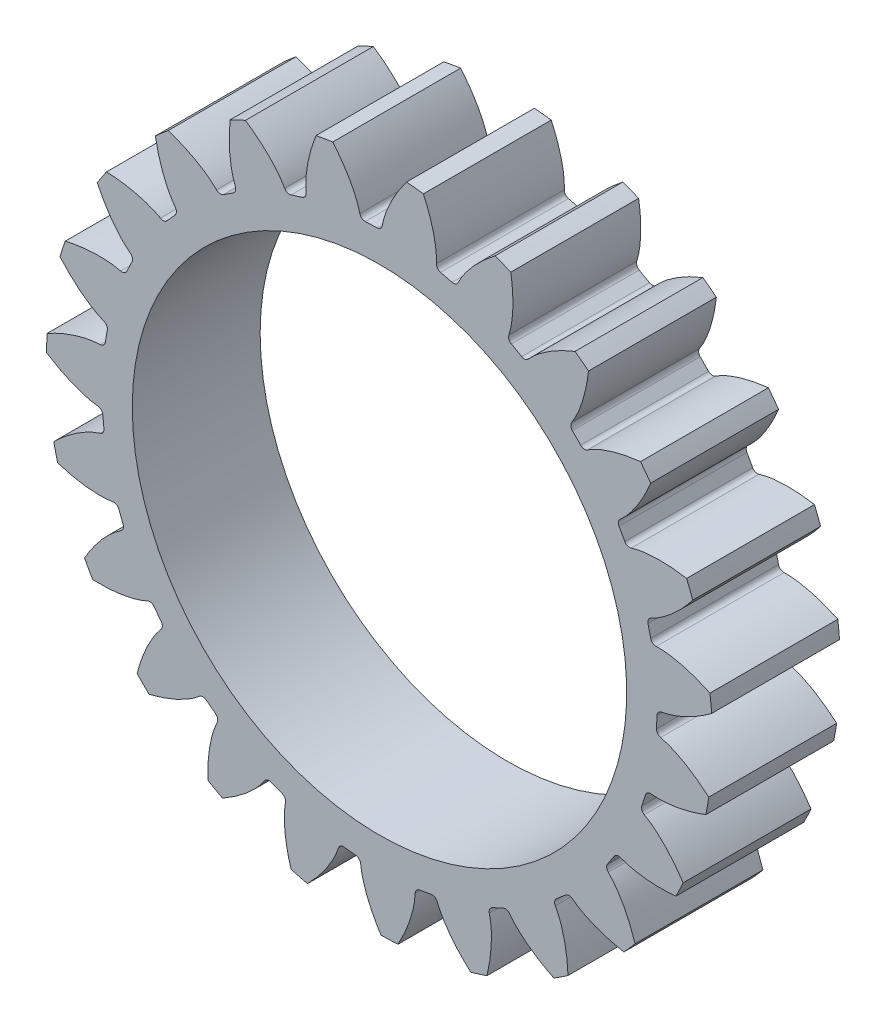
from build123d import *

# Parameters (mm, degrees)
SKETCH2_R                = 15.625
BOSS_EXTRUDE1_DEPTH      = 6
CUT_EXTRUDE1_DEPTH       = 6
FILLET1_R                = 0.254
CIRPATTERN3_COUNT        = 23
FILLET1_OF_CIRPATTERN3_R = 0.254
SKETCH3_R                = 11.6
CUT_EXTRUDE2_DEPTH       = 23.896192992


# Read off the part's stored shape, not the designer's step: Cut-Extrude1
with BuildPart() as part:
    # Sketch2 → Boss-Extrude1 (new body)
    with BuildSketch(Plane.XY):
        Circle(SKETCH2_R)
    extrude(amount=BOSS_EXTRUDE1_DEPTH)

    # Cut-Extrude1 outline → Cut-Extrude1 (cut)
    with BuildSketch(Plane.XY):
        with BuildLine():
            add(Edge.make_bspline(
                [(13.028174439, 0), (13.037808366, 0), (13.064821474, 0.000631069), (13.115831028, 0.0043156), (13.198797279, 0.01385792), (13.303979208, 0.031186883), (13.43906131, 0.059488799), (13.596839078, 0.100372564), (13.76851171, 0.153140094), (13.953119759, 0.218915784), (14.135143741, 0.291864901), (14.314504286, 0.371371816), (14.491035879, 0.456601071), (14.702118225, 0.566855808), (14.951249007, 0.708760704), (15.203559846, 0.867927626), (15.407973595, 1.008686756), (15.535582782, 1.101519993), (15.583567283, 1.137126088)],
                knots=[0, 0, 0, 0, 0, 0.005376748, 0.015083688, 0.02853182, 0.046610139, 0.064854849, 0.092110525, 0.119476175, 0.146842495, 0.174208853, 0.201574955, 0.228941013, 0.256307345, 0.307035032, 0.361767351, 0.395094932, 0.395094932, 0.395094932, 0.395094932, 0.395094932], degree=4))
            Line((13.028174439, 0), (12.989931143, -0.997505944))
            add(Edge.make_bspline(
                [(15.450758422, -2.32694847), (15.405640967, -2.287772946), (15.285514172, -2.185441781), (15.092477729, -2.029444841), (14.853094192, -1.85142689), (14.615559705, -1.690863776), (14.413538663, -1.564771103), (14.244050868, -1.46627584), (14.071304294, -1.37326952), (13.895400001, -1.286597822), (13.71636999, -1.206880642), (13.549241453, -1.141123844), (13.395057108, -1.088279789), (13.262538474, -1.049718352), (13.158992096, -1.024386972), (13.076999997, -1.008520327), (13.026422285, -1.000941051), (12.999536791, -0.998243568), (12.989931143, -0.997505944)],
                knots=[0.513995984, 0.513995984, 0.513995984, 0.513995984, 0.513995984, 0.547323565, 0.602055884, 0.652783571, 0.680149903, 0.707515961, 0.734882063, 0.762248421, 0.789614741, 0.816980391, 0.844236067, 0.862480777, 0.880559096, 0.894007228, 0.903714168, 0.909090916, 0.909090916, 0.909090916, 0.909090916, 0.909090916], degree=4))
            ThreePointArc((15.450758422, -2.32694847), (15.613529266, -0.598605775), (15.583567283, 1.137126088))
        make_face()
    cut_extrude1 = extrude(amount=CUT_EXTRUDE1_DEPTH, mode=Mode.SUBTRACT)

    # Fillet1
    fillet1_edges = [part.edges().sort_by_distance(p)[0] for p in [
        (12.989931143, -0.997505944, 3),
        (13.028174439, 0, 3),
    ]]
    fillet(fillet1_edges, radius=FILLET1_R)

    # CirPattern3: Cut-Extrude1 ×23 about axis
    cirpattern3_axis = Axis((0, 0, 18.908609159), (0, 0, -1))
    for i in range(1, CIRPATTERN3_COUNT):
        add(cut_extrude1.rotate(cirpattern3_axis, i * 360 / CIRPATTERN3_COUNT), mode=Mode.SUBTRACT)

    # Fillet1 of CirPattern3
    fillet1_of_cirpattern3_edges = [part.edges().sort_by_distance(p)[0] for p in [
        (12.239105376, -4.465157198, 3),
        (12.54505439, -3.514959398, 3),
        (10.580561154, -7.601648169, 3),
        (11.131525046, -6.769230337, 3),
        (8.137305113, -10.17435967, 3),
        (8.892421414, -9.521458429, 3),
        (5.090542378, -11.99248546, 3),
        (5.993807565, -11.567523507, 3),
        (1.666237403, -12.921183465, 3),
        (2.650660429, -12.755678285, 3),
        (-1.881644778, -12.891576402, 3),
        (-0.889074065, -12.997802757, 3),
        (-5.289973974, -11.905860093, 3),
        (-4.362870003, -12.27593966, 3),
        (-8.30597, -10.037140607, 3),
        (-7.513091832, -10.643626278, 3),
        (-10.705950229, -7.424012319, 3),
        (-10.10610201, -8.221923825, 3),
        (-12.311919105, -4.260278999, 3),
        (-11.949588833, -5.190438895, 3),
        (-13.004769265, -0.780580276, 3),
        (-12.906829319, -1.774002857, 3),
        (-12.733115182, 2.757010516, 3),
        (-12.906829319, 1.774002857, 3),
        (-11.517104195, 6.09012645, 3),
        (-11.949588833, 5.190438895, 3),
        (-9.446922277, 8.971565565, 3),
        (-10.10610201, 8.221923825, 3),
        (-6.676105351, 11.187624705, 3),
        (-7.513091832, 10.643626278, 3),
        (-3.410152233, 12.573948901, 3),
        (-4.362870003, 12.27593966, 3),
        (0.108716277, 13.027720828, 3),
        (-0.889074065, 12.997802757, 3),
        (3.619521797, 12.5152863, 3),
        (2.650660429, 12.755678285, 3),
        (6.861883944, 11.07465024, 3),
        (5.993807565, 11.567523507, 3),
        (9.59533155, 8.812658035, 3),
        (8.892421414, 9.521458429, 3),
        (11.617137311, 5.897071299, 3),
        (11.131525046, 6.769230337, 3),
        (12.777353142, 2.544125762, 3),
        (12.54505439, 3.514959398, 3),
    ]]
    fillet(fillet1_of_cirpattern3_edges, radius=FILLET1_OF_CIRPATTERN3_R)

    # Sketch3 → Cut-Extrude2 (cut, through all)
    with BuildSketch(Plane(origin=(0, 0, 0), x_dir=(-1, 0, 0), z_dir=(0, 0, -1))):
        Circle(SKETCH3_R)
    extrude(amount=-CUT_EXTRUDE2_DEPTH, mode=Mode.SUBTRACT)


solid = part.part
